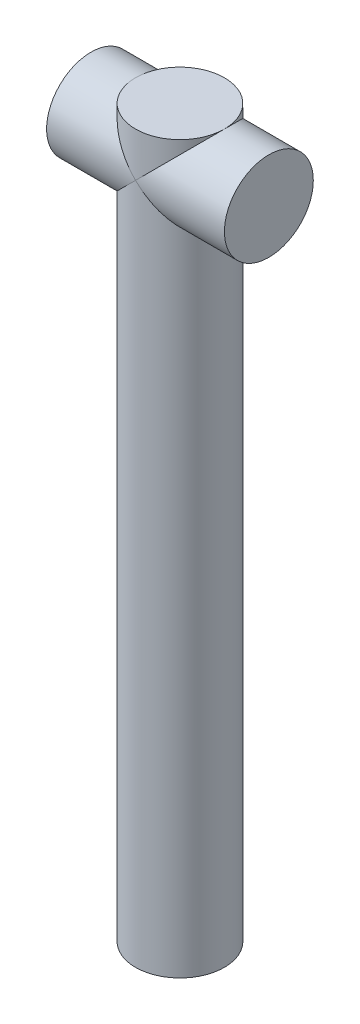
from build123d import *

# Parameters (mm, degrees)
ESBO_O1_R                     = 15
RESSALTO_EXTRUS_O1_DEPTH      = 245
RESSALTO_EXTRUS_O2_DEPTH      = 30
RESSALTO_EXTRUS_O2_DEPTH_BACK = 30
ESBO_O3_R                     = 15


with BuildPart() as part:
    # Esboço1 → Ressalto-extrusão1 (new body)
    with BuildSketch(Plane(origin=(0, 0, 0), x_dir=(1, 0, 0), z_dir=(0, 1, 0))):
        Circle(ESBO_O1_R)
    extrude(amount=-RESSALTO_EXTRUS_O1_DEPTH)

    # Esboço3 → Ressalto-extrusão2 (add, two sides: drawn at the far end of the back side and taken through both)
    with BuildSketch(Plane(origin=(0, 0, 0), x_dir=(0, 0, -1), z_dir=(1, 0, 0)).offset(-RESSALTO_EXTRUS_O2_DEPTH_BACK)):
        with Locations((0, -15)):
            Circle(ESBO_O3_R)
    extrude(amount=RESSALTO_EXTRUS_O2_DEPTH + RESSALTO_EXTRUS_O2_DEPTH_BACK)


solid = part.part
